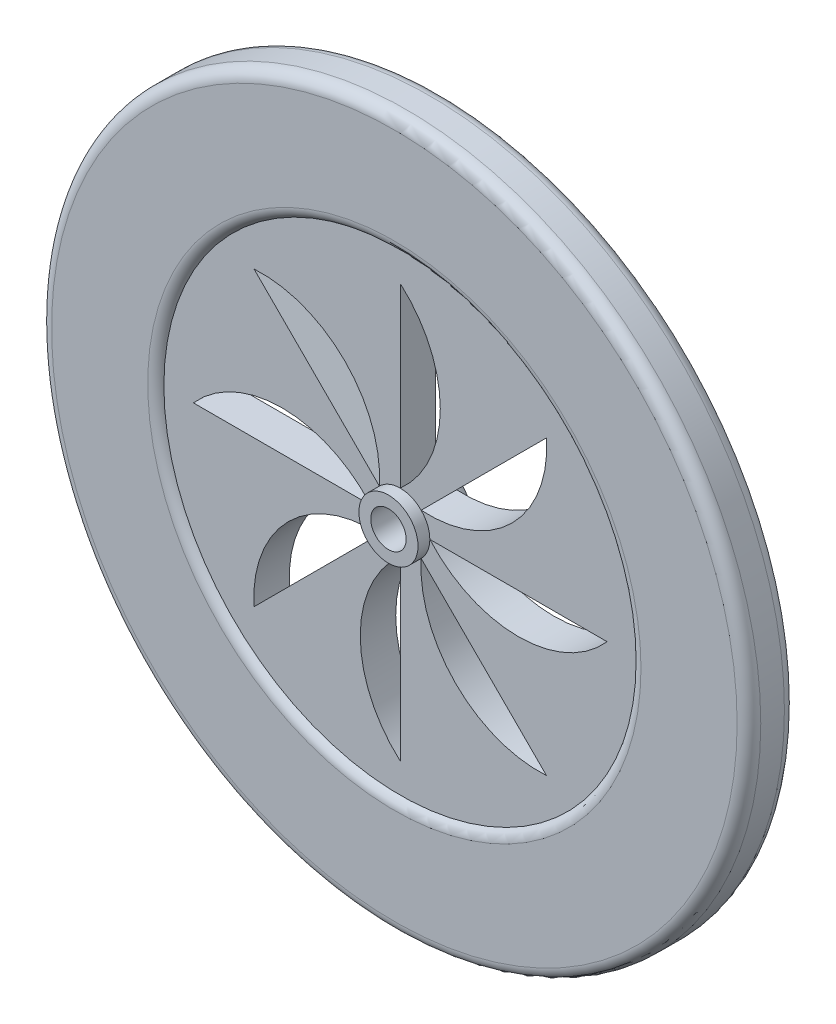
from build123d import *

# Parameters (mm, degrees)
SKETCH1_R           = 2.5
BOSS_EXTRUDE5_DEPTH = 2.5
SKETCH7_R           = 20
BOSS_EXTRUDE6_DEPTH = 1.5
CUT_EXTRUDE5_DEPTH  = 3
SKETCH9_R           = 30
SKETCH9_R_2         = 20
BOSS_EXTRUDE8_DEPTH = 2
SKETCH10_R          = 1.5
CUT_EXTRUDE6_DEPTH  = 2
CUT_EXTRUDE7_DEPTH  = 2
FILLET1_R           = 1
FILLET2_R           = 1


# Some blends are built 0.0001 mm under size
with BuildPart() as part:
    # Sketch1 → Boss-Extrude5 (new, symmetric)
    with BuildSketch(Plane.XY):
        Circle(SKETCH1_R)
    extrude(amount=BOSS_EXTRUDE5_DEPTH, both=True)

    # Sketch7 → Boss-Extrude6 (add, symmetric)
    with BuildSketch(Plane.XY):
        Circle(SKETCH7_R)
    extrude(amount=BOSS_EXTRUDE6_DEPTH, both=True)

    # Sketch8 → Cut-Extrude5 (cut)
    with BuildSketch(Plane.XY.offset(1.5)):
        with BuildLine():
            Line((0, 2.5), (0, 17.5))
            ThreePointArc((0, 17.5), (3.385621722, 10), (0, 2.5))
        make_face()
        with BuildLine():
            Line((1.767766953, 1.767766953), (12.374368671, 12.374368671))
            ThreePointArc((12.374368671, 12.374368671), (9.46506389, 4.677071733), (1.767766953, 1.767766953))
        make_face()
        with BuildLine():
            Line((2.5, 0), (17.5, 0))
            ThreePointArc((17.5, 0), (10, -3.385621722), (2.5, 0))
        make_face()
        with BuildLine():
            Line((1.767766953, -1.767766953), (12.374368671, -12.374368671))
            ThreePointArc((12.374368671, -12.374368671), (4.677071733, -9.46506389), (1.767766953, -1.767766953))
        make_face()
        with BuildLine():
            Line((0, -2.5), (0, -17.5))
            ThreePointArc((0, -17.5), (-3.385621722, -10), (0, -2.5))
        make_face()
        with BuildLine():
            Line((-1.767766953, -1.767766953), (-12.374368671, -12.374368671))
            ThreePointArc((-12.374368671, -12.374368671), (-9.46506389, -4.677071733), (-1.767766953, -1.767766953))
        make_face()
        with BuildLine():
            Line((-2.5, 0), (-17.5, 0))
            ThreePointArc((-17.5, 0), (-10, 3.385621722), (-2.5, 0))
        make_face()
        with BuildLine():
            Line((-1.767766953, 1.767766953), (-12.374368671, 12.374368671))
            ThreePointArc((-12.374368671, 12.374368671), (-4.677071733, 9.46506389), (-1.767766953, 1.767766953))
        make_face()
    extrude(amount=-CUT_EXTRUDE5_DEPTH, mode=Mode.SUBTRACT)

    # Sketch9 → Boss-Extrude8 (add, symmetric)
    with BuildSketch(Plane.XY):
        Circle(SKETCH9_R)
        Circle(SKETCH9_R_2, mode=Mode.SUBTRACT)
    extrude(amount=BOSS_EXTRUDE8_DEPTH, both=True)

    # Sketch10 → Cut-Extrude6 (cut)
    with BuildSketch(Plane.XY.offset(2.5)):
        Circle(SKETCH10_R)
    extrude(amount=-CUT_EXTRUDE6_DEPTH, mode=Mode.SUBTRACT)

    # Sketch11 → Cut-Extrude7 (cut)
    with BuildSketch(Plane.XY.offset(0.5)):
        with BuildLine():
            Line((-1.5, 0), (1.5, 0))
            ThreePointArc((1.5, 0), (0, -1.5), (-1.5, 0))
        make_face()
    extrude(amount=-CUT_EXTRUDE7_DEPTH, mode=Mode.SUBTRACT)

    # Fillet1
    fillet1_edges = [part.edges().sort_by_distance(p)[0] for p in [
        (-2.5, 0, -2.5),
    ]]
    fillet(fillet1_edges, radius=FILLET1_R - 0.0001)  # a hair under: the kernel refuses the full size

    # Fillet2
    # the kernel refuses this fillet: 1 mm, written as the material it takes off along each edge
    with BuildSketch(Plane(origin=(0, 0, 2), x_dir=(1, 0, 0), z_dir=(0, -1, 0))) as fillet2_piece_1:
        with BuildLine():
            CenterArc((30 - FILLET2_R, -FILLET2_R), FILLET2_R, 0, 90)
            Line((30 - FILLET2_R, 0), (30 - FILLET2_R, FILLET2_R * 0.02))
            Line((30 - FILLET2_R, FILLET2_R * 0.02), (30 + FILLET2_R * 0.02, FILLET2_R * 0.02))
            Line((30 + FILLET2_R * 0.02, FILLET2_R * 0.02), (30 + FILLET2_R * 0.02, -FILLET2_R))
            Line((30 + FILLET2_R * 0.02, -FILLET2_R), (30, -FILLET2_R))
        make_face()
    revolve(axis=Axis((0, 0, 2), (0, 0, 1)), mode=Mode.SUBTRACT)
    with BuildSketch(Plane(origin=(0, 0, -2), x_dir=(1, 0, 0), z_dir=(0, -1, 0))) as fillet2_piece_2:
        with BuildLine():
            CenterArc((20.866025404, 1), FILLET2_R, 210, 60)
            Line((20.866025404, 0), (20.866025404, -0.02))
            Line((20.866025404, -0.02), (20, -0.02))
            Line((20, -0.02), (19.98, 0))
            ThreePointArc((19.98, 0), (19.98, 0.25), (19.982679492, 0.49))
            Line((19.982679492, 0.49), (20, 0.5))
        make_face()
    revolve(axis=Axis((0, 0, -2), (0, 0, 1)), mode=Mode.SUBTRACT)
    with BuildSketch(Plane(origin=(0, 0, -2), x_dir=(1, 0, 0), z_dir=(0, -1, 0))) as fillet2_piece_3:
        with BuildLine():
            CenterArc((30 - FILLET2_R, FILLET2_R), FILLET2_R, 270, 90)
            Line((30, FILLET2_R), (30 + FILLET2_R * 0.02, FILLET2_R))
            Line((30 + FILLET2_R * 0.02, FILLET2_R), (30 + FILLET2_R * 0.02, -FILLET2_R * 0.02))
            Line((30 + FILLET2_R * 0.02, -FILLET2_R * 0.02), (30 - FILLET2_R, -FILLET2_R * 0.02))
            Line((30 - FILLET2_R, -FILLET2_R * 0.02), (30 - FILLET2_R, 0))
        make_face()
    revolve(axis=Axis((0, 0, -2), (0, 0, 1)), mode=Mode.SUBTRACT)
    with BuildSketch(Plane(origin=(0, 0, 2), x_dir=(1, 0, 0), z_dir=(0, -1, 0))) as fillet2_piece_4:
        with BuildLine():
            CenterArc((20.866025404, -1), FILLET2_R, 90, 60)
            Line((20.866025404, 0), (20.866025404, 0.02))
            Line((20.866025404, 0.02), (20, 0.02))
            Line((20, 0.02), (19.98, 0))
            ThreePointArc((19.98, 0), (19.98, -0.25), (19.982679492, -0.49))
            Line((19.982679492, -0.49), (20, -0.5))
        make_face()
    revolve(axis=Axis((0, 0, 2), (0, 0, 1)), mode=Mode.SUBTRACT)


solid = part.part
